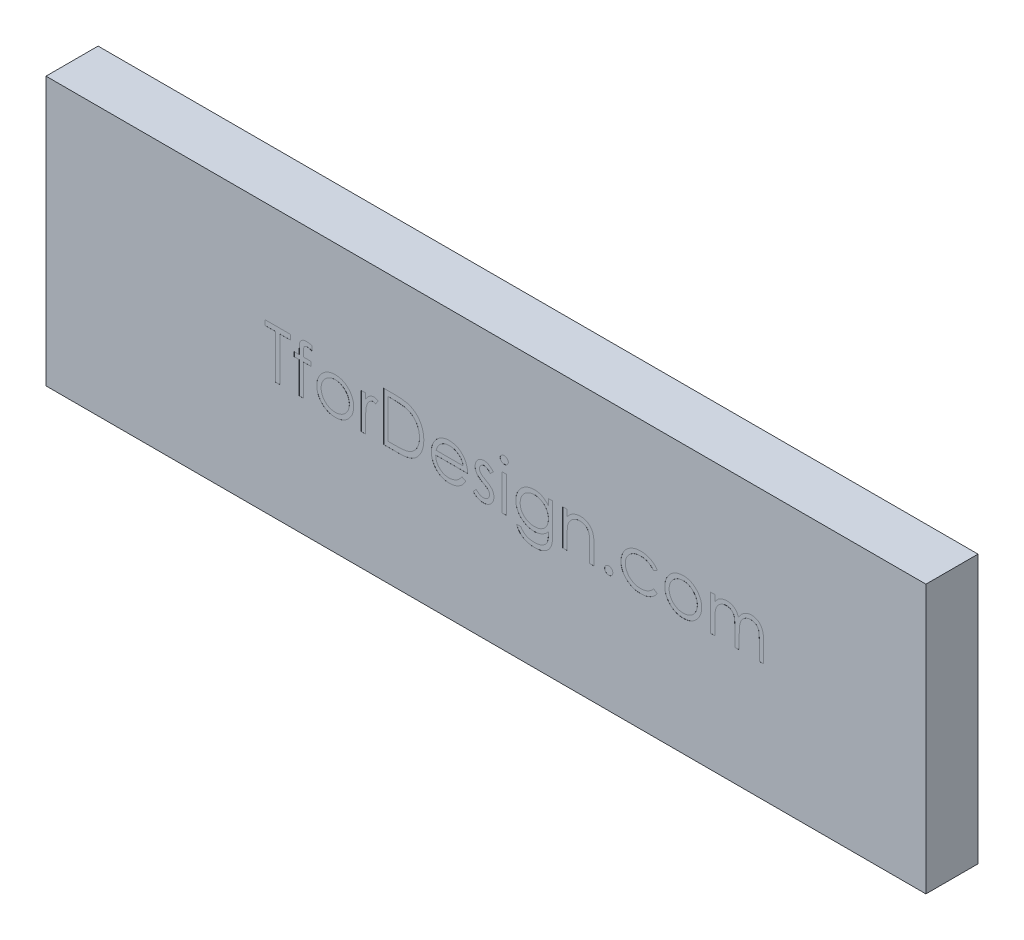
from build123d import *

# Parameters (mm, degrees)
SKETCH1_W           = 42.920186872
SKETCH1_H           = 13.085422827
BOSS_EXTRUDE1_DEPTH = 2.54
SKETCH2_W           = 0.213701923
SKETCH2_H           = 1.740144231
CUT_EXTRUDE1_DEPTH  = 0.00254


with BuildPart() as part:
    # Sketch1 → Boss-Extrude1 (new body)
    with BuildSketch(Plane.XY):
        with Locations((0.924247782, -12.002110783)):
            Rectangle(SKETCH1_W, SKETCH1_H)
    extrude(amount=BOSS_EXTRUDE1_DEPTH)

    # Sketch2 → Cut-Extrude1 (cut)
    # profile 1 of 15: a face of its own
    with BuildSketch(Plane.XY.offset(2.54)):
        Polygon((-9.862506242, -10.650216921), (-9.862506242, -10.405986152), (-8.610823549, -10.405986152), (-8.610823549, -10.650216921), (-9.129813934, -10.650216921), (-9.129813934, -12.787236152), (-9.343515857, -12.787236152), (-9.343515857, -10.650216921), align=None)
    # profile 2 of 15: a face of its own
    with BuildSketch(Plane.XY.offset(2.54)):
        with BuildLine():
            Line((-7.57284278, -10.359238857), (-7.57284278, -10.581527018))
            add(Edge.make_bspline(
                [(-7.57284278, -10.581527018), (-7.593075771, -10.573396156), (-7.631478408, -10.557963613), (-7.688111592, -10.541182858), (-7.740178531, -10.530340864), (-7.773620731, -10.528819623), (-7.789406782, -10.528101537)],
                knots=[0, 0, 0, 0, 1.16548392, 2.212112691, 3.15604595, 4, 4, 4, 4], degree=3))
            add(Edge.make_bspline(
                [(-7.789406782, -10.528101537), (-7.80007054, -10.528544681), (-7.820712017, -10.52940246), (-7.850377852, -10.533775983), (-7.877108546, -10.542690567), (-7.900856835, -10.554276557), (-7.920553487, -10.568805029), (-7.937416972, -10.583402271), (-7.949640628, -10.599856831), (-7.956277477, -10.615178753), (-7.960325602, -10.629364875), (-7.961543529, -10.643893403), (-7.964526836, -10.661735147), (-7.965358782, -10.683617962), (-7.967255188, -10.708861056), (-7.967087384, -10.737998641), (-7.968641267, -10.770572197), (-7.968408643, -10.793636678), (-7.96828674, -10.805723232)],
                knots=[0, 0, 0, 0, 1.311993654, 2.539582093, 3.670788641, 4.763509788, 5.772417512, 6.671800701, 7.496729179, 8.266799162, 8.712543678, 9.304149002, 10.05334463, 10.934920737, 11.99209668, 13.165090968, 14.514413552, 16, 16, 16, 16], degree=3))
            Line((-7.96828674, -10.805723232), (-7.96828674, -11.047091921))
            Line((-7.96828674, -11.047091921), (-7.603371626, -11.047091921))
            Line((-7.603371626, -11.047091921), (-7.603371626, -11.260793844))
            Line((-7.603371626, -11.260793844), (-7.968763754, -11.260793844))
            Line((-7.968763754, -11.260793844), (-7.96971778, -12.787236152))
            Line((-7.96971778, -12.787236152), (-8.183419703, -12.787236152))
            Line((-8.183419703, -12.787236152), (-8.183419703, -11.260793844))
            Line((-8.183419703, -11.260793844), (-8.427650472, -11.260793844))
            Line((-8.427650472, -11.260793844), (-8.427650472, -11.047091921))
            Line((-8.427650472, -11.047091921), (-8.183419703, -11.047091921))
            Line((-8.183419703, -11.047091921), (-8.183419703, -10.768993213))
            add(Edge.make_bspline(
                [(-8.183419703, -10.768993213), (-8.183402548, -10.753565721), (-8.183369639, -10.72396957), (-8.18106469, -10.68137279), (-8.179094566, -10.642032183), (-8.175170519, -10.606253131), (-8.17063818, -10.573700666), (-8.164150186, -10.544858366), (-8.158019235, -10.518949169), (-8.146896354, -10.489623969), (-8.130280522, -10.456388506), (-8.103385871, -10.421265817), (-8.0711417, -10.389761916), (-8.032627822, -10.363222984), (-7.989278503, -10.341168882), (-7.941053987, -10.325356122), (-7.888479254, -10.316415926), (-7.852088672, -10.315086366), (-7.833291999, -10.314399614)],
                knots=[0, 0, 0, 0, 1.116398763, 2.141702935, 3.087165306, 3.966655413, 4.746276475, 5.464069668, 6.106083417, 6.67047701, 7.730773247, 8.782666744, 9.856985883, 10.980834087, 12.154321827, 13.366232824, 14.639591414, 16, 16, 16, 16], degree=3))
            add(Edge.make_bspline(
                [(-7.833291999, -10.314399614), (-7.814189776, -10.315050974), (-7.774085672, -10.316418472), (-7.711359055, -10.324877629), (-7.643597853, -10.339485598), (-7.597105021, -10.352465373), (-7.57284278, -10.359238857)],
                knots=[0, 0, 0, 0, 0.864728408, 1.815451418, 2.859995356, 4, 4, 4, 4], degree=3))
        make_face()
    # profile 3 of 15: a face of its own
    with BuildSketch(Plane.XY.offset(2.54)):
        with BuildLine():
            add(Edge.make_bspline(
                [(-6.427057023, -11.016563075), (-6.394405818, -11.017258326), (-6.330384784, -11.018621543), (-6.236626204, -11.033191368), (-6.147128531, -11.055471271), (-6.061548997, -11.086272102), (-5.980983625, -11.127557501), (-5.904258903, -11.176821679), (-5.831585188, -11.235184479), (-5.788026663, -11.280331665), (-5.765916698, -11.303248021)],
                knots=[0, 0, 0, 0, 1.054011418, 2.066658804, 3.057071809, 4.030435133, 4.997543892, 5.974964718, 6.972108034, 8, 8, 8, 8], degree=3))
            add(Edge.make_bspline(
                [(-5.765916698, -11.303248021), (-5.746878976, -11.325165037), (-5.709171964, -11.368574913), (-5.660821894, -11.438961678), (-5.619169369, -11.511855211), (-5.585789033, -11.588223481), (-5.5594694, -11.66739982), (-5.540782918, -11.749656367), (-5.529667967, -11.834811464), (-5.528169163, -11.892644432), (-5.527410088, -11.921934169)],
                knots=[0, 0, 0, 0, 1.025258237, 2.030674902, 3.01204498, 3.988269485, 4.97094183, 5.956517959, 6.965070386, 8, 8, 8, 8], degree=3))
            add(Edge.make_bspline(
                [(-5.527410088, -11.921934169), (-5.528077748, -11.951393673), (-5.529397075, -12.009607025), (-5.541877285, -12.095345201), (-5.561288613, -12.178481321), (-5.589068846, -12.258667326), (-5.62469106, -12.336148321), (-5.668159545, -12.410585889), (-5.719779342, -12.482126894), (-5.778292775, -12.550163859), (-5.842961998, -12.612869802), (-5.913117806, -12.667521713), (-5.987381533, -12.714344929), (-6.066740671, -12.752061491), (-6.150470515, -12.781799697), (-6.238751663, -12.802686673), (-6.33144697, -12.815315247), (-6.394738705, -12.816936928), (-6.427057023, -12.817764998)],
                knots=[0, 0, 0, 0, 0.998656419, 1.973391657, 2.932242238, 3.890759089, 4.846373663, 5.82037756, 6.809684879, 7.83454468, 8.860553229, 9.859544525, 10.845671541, 11.83227036, 12.833544569, 13.85385346, 14.904124723, 16, 16, 16, 16], degree=3))
            add(Edge.make_bspline(
                [(-6.427057023, -12.817764998), (-6.45953368, -12.816934149), (-6.523140854, -12.815306888), (-6.616163353, -12.802735737), (-6.704602719, -12.781809323), (-6.788442176, -12.751963761), (-6.868142509, -12.714343724), (-6.942836537, -12.667663271), (-7.013049336, -12.612853594), (-7.07773224, -12.550168251), (-7.136242005, -12.482125762), (-7.187862749, -12.410586183), (-7.231330988, -12.336148244), (-7.266953266, -12.258667346), (-7.294733482, -12.178481316), (-7.314144815, -12.095345203), (-7.326625024, -12.009607025), (-7.327944351, -11.951393672), (-7.328612011, -11.921934169)],
                knots=[0, 0, 0, 0, 1.099876186, 2.154163076, 3.173186993, 4.173200201, 5.163417411, 6.152872554, 7.150605724, 8.17532212, 9.198891216, 10.186952605, 11.159729845, 12.11414092, 13.071450619, 14.029093627, 15.002601286, 16, 16, 16, 16], degree=3))
            add(Edge.make_bspline(
                [(-7.328612011, -11.921934169), (-7.327847759, -11.892803626), (-7.326334671, -11.835130158), (-7.315230896, -11.75013514), (-7.296617306, -11.668017809), (-7.270266124, -11.589147083), (-7.23657811, -11.513113474), (-7.195510877, -11.44003983), (-7.146667607, -11.369971345), (-7.109110565, -11.326617572), (-7.0901054, -11.304679061)],
                knots=[0, 0, 0, 0, 1.031353054, 2.041901799, 3.029428768, 4.008703097, 4.981709435, 5.96992636, 6.972712378, 8, 8, 8, 8], degree=3))
            add(Edge.make_bspline(
                [(-7.0901054, -11.304679061), (-7.06802877, -11.281563968), (-7.024611191, -11.236104071), (-6.951575717, -11.177911408), (-6.875039742, -11.127622079), (-6.793584034, -11.087157011), (-6.708074804, -11.055290091), (-6.618118497, -11.03313391), (-6.524041763, -11.018674038), (-6.459707449, -11.017273742), (-6.427057023, -11.016563075)],
                knots=[0, 0, 0, 0, 1.027980169, 2.021703884, 2.998553061, 3.971491411, 4.943284454, 5.930300938, 6.949603206, 8, 8, 8, 8], degree=3))
        make_face()
        with BuildLine():
            add(Edge.make_bspline(
                [(-6.428011049, -11.230264998), (-6.451100746, -11.230921265), (-6.496684081, -11.232216857), (-6.56378062, -11.242071085), (-6.628373832, -11.257683584), (-6.690586264, -11.279865986), (-6.750208118, -11.308508273), (-6.80729648, -11.343688425), (-6.862019265, -11.38494049), (-6.91330599, -11.432199915), (-6.96037467, -11.483824731), (-7.001521293, -11.538830489), (-7.036508732, -11.596324986), (-7.06565534, -11.656368008), (-7.087363623, -11.719568025), (-7.103129555, -11.785209312), (-7.112974486, -11.853425604), (-7.114257897, -11.89979944), (-7.114910088, -11.923365209)],
                knots=[0, 0, 0, 0, 1.021534396, 2.016698045, 2.994645724, 3.958388632, 4.93408049, 5.916473867, 6.921342795, 7.962252576, 8.998418191, 10.008913653, 10.997312074, 11.973003931, 12.956656626, 13.948281152, 14.957379055, 16, 16, 16, 16], degree=3))
            add(Edge.make_bspline(
                [(-7.114910088, -11.923365209), (-7.113816874, -11.95381257), (-7.111647049, -12.014244889), (-7.094001825, -12.10324317), (-7.06448366, -12.188683681), (-7.024623386, -12.270065543), (-6.97468094, -12.345362218), (-6.915838847, -12.412494067), (-6.848728622, -12.470450843), (-6.774150253, -12.518539061), (-6.693627048, -12.556747752), (-6.608408015, -12.583825269), (-6.519525686, -12.60142726), (-6.458782902, -12.603176781), (-6.428011049, -12.604063075)],
                knots=[0, 0, 0, 0, 1.016792936, 2.018143844, 3.017858371, 4.030088057, 5.03801393, 6.028138512, 7.003788237, 7.991172063, 8.984598303, 9.972568034, 10.972917682, 12, 12, 12, 12], degree=3))
            add(Edge.make_bspline(
                [(-6.428011049, -12.604063075), (-6.397240966, -12.603171617), (-6.336501677, -12.601411902), (-6.247742844, -12.58391392), (-6.162756731, -12.556629108), (-6.082317162, -12.518582033), (-6.007772741, -12.470268229), (-5.940179856, -12.412821337), (-5.881840176, -12.345184413), (-5.831947134, -12.269965808), (-5.791434083, -12.188809848), (-5.762054083, -12.103227401), (-5.74436644, -12.014248905), (-5.74220234, -11.953813915), (-5.741112011, -11.923365209)],
                knots=[0, 0, 0, 0, 1.02726834, 2.027799167, 3.010890988, 4.004497153, 4.992059811, 5.971914811, 6.958719428, 7.966827853, 8.981595046, 9.981490638, 10.983022906, 12, 12, 12, 12], degree=3))
            add(Edge.make_bspline(
                [(-5.741112011, -11.923365209), (-5.741763977, -11.899799299), (-5.743046946, -11.853425186), (-5.752895091, -11.78521091), (-5.768649128, -11.719562163), (-5.790401246, -11.656389639), (-5.819421209, -11.596169524), (-5.855083349, -11.538999299), (-5.896061957, -11.483634185), (-5.943698606, -11.432366797), (-5.994931797, -11.384922067), (-6.04967676, -11.343672429), (-6.106680469, -11.308662886), (-6.166129112, -11.279620998), (-6.228349519, -11.257885396), (-6.292852227, -11.241980938), (-6.359662489, -11.232258501), (-6.40508248, -11.230933749), (-6.428011049, -11.230264998)],
                knots=[0, 0, 0, 0, 1.042956736, 2.052379634, 3.044323526, 4.02829302, 5.004299113, 5.996692471, 7.007513377, 8.048758398, 9.090003419, 10.095195979, 11.07790575, 12.047570684, 13.018257071, 13.989683339, 14.985167495, 16, 16, 16, 16], degree=3))
        make_face(mode=Mode.SUBTRACT)
    # profile 4 of 15: a face of its own
    with BuildSketch(Plane.XY.offset(2.54)):
        with BuildLine():
            Line((-5.161063934, -11.047091921), (-4.947362011, -11.047091921))
            Line((-4.947362011, -11.047091921), (-4.947362011, -11.303248021))
            add(Edge.make_bspline(
                [(-4.947362011, -11.303248021), (-4.931585373, -11.279397538), (-4.901412676, -11.233783674), (-4.851261558, -11.173456882), (-4.799892328, -11.123508431), (-4.747059066, -11.083705144), (-4.692373252, -11.053896575), (-4.637035076, -11.03206185), (-4.580173908, -11.019150498), (-4.541963741, -11.017426705), (-4.522820244, -11.016563075)],
                knots=[0, 0, 0, 0, 1.2804753, 2.448899062, 3.506932113, 4.484331642, 5.4025378, 6.288909075, 7.142734305, 8, 8, 8, 8], degree=3))
            add(Edge.make_bspline(
                [(-4.522820244, -11.016563075), (-4.507970547, -11.017373059), (-4.47741633, -11.019039652), (-4.431163889, -11.030749159), (-4.383509327, -11.049444028), (-4.352796381, -11.067024608), (-4.336785088, -11.076189728)],
                knots=[0, 0, 0, 0, 0.901110191, 1.854092781, 2.881294221, 4, 4, 4, 4], degree=3))
            Line((-4.336785088, -11.076189728), (-4.45413034, -11.261270858))
            add(Edge.make_bspline(
                [(-4.45413034, -11.261270858), (-4.464409871, -11.25668507), (-4.483922387, -11.247980366), (-4.512466476, -11.237678391), (-4.5387836, -11.231612384), (-4.555550021, -11.230693414), (-4.563366368, -11.230264998)],
                knots=[0, 0, 0, 0, 1.180555205, 2.24091978, 3.179933427, 4, 4, 4, 4], degree=3))
            add(Edge.make_bspline(
                [(-4.563366368, -11.230264998), (-4.580515269, -11.231408024), (-4.615494055, -11.233739464), (-4.666850474, -11.252067475), (-4.716684733, -11.281680183), (-4.756262239, -11.314521778), (-4.786907058, -11.346190905), (-4.80877389, -11.373846336), (-4.828832687, -11.404856083), (-4.847998498, -11.438690029), (-4.865460744, -11.475925871), (-4.881758475, -11.516191593), (-4.896494237, -11.559533832), (-4.904896814, -11.589729797), (-4.909200953, -11.60519739)],
                knots=[0, 0, 0, 0, 1.125678352, 2.296057538, 3.5422874, 4.923748041, 5.663163013, 6.437101912, 7.23742474, 8.08941207, 8.991984279, 9.93940061, 10.944477711, 12, 12, 12, 12], degree=3))
            add(Edge.make_bspline(
                [(-4.909200953, -11.60519739), (-4.912420671, -11.61899311), (-4.919552101, -11.649549581), (-4.926485986, -11.700813488), (-4.933336855, -11.76138137), (-4.93816509, -11.83142182), (-4.942640508, -11.910759929), (-4.945164689, -11.999516564), (-4.947275932, -12.097782826), (-4.947332448, -12.166481448), (-4.947362011, -12.202417943)],
                knots=[0, 0, 0, 0, 0.566838948, 1.255505196, 2.06880316, 3.007127437, 4.065329342, 5.249902469, 6.561414163, 8, 8, 8, 8], degree=3))
            Line((-4.947362011, -12.202417943), (-4.947362011, -12.787236152))
            Line((-4.947362011, -12.787236152), (-5.161063934, -12.787236152))
            Line((-5.161063934, -12.787236152), (-5.161063934, -11.047091921))
        make_face()
    # profile 5 of 15: a face of its own
    with BuildSketch(Plane.XY.offset(2.54)):
        with BuildLine():
            Line((-4.062025472, -12.787236152), (-4.062025472, -10.405986152))
            Line((-4.062025472, -10.405986152), (-3.581196145, -10.405986152))
            add(Edge.make_bspline(
                [(-3.581196145, -10.405986152), (-3.53937528, -10.406287258), (-3.458577586, -10.406868992), (-3.341819832, -10.410557475), (-3.233790165, -10.417082417), (-3.134843881, -10.426586683), (-3.044709342, -10.438256872), (-2.963638931, -10.452884826), (-2.891213456, -10.470157849), (-2.846670854, -10.484884486), (-2.825607203, -10.491848532)],
                knots=[0, 0, 0, 0, 1.314313732, 2.53924729, 3.670748893, 4.714932338, 5.66265055, 6.526160246, 7.303039223, 8, 8, 8, 8], degree=3))
            add(Edge.make_bspline(
                [(-2.825607203, -10.491848532), (-2.798056318, -10.502346923), (-2.74357931, -10.523105636), (-2.66601375, -10.562264476), (-2.592994173, -10.606632676), (-2.524129005, -10.656268718), (-2.4609913, -10.712578034), (-2.401114498, -10.773168658), (-2.346948052, -10.84024394), (-2.297344372, -10.912412816), (-2.252620647, -10.988825123), (-2.213745613, -11.069335259), (-2.181459949, -11.153534359), (-2.154658486, -11.241188273), (-2.133535807, -11.332489737), (-2.119124529, -11.427545064), (-2.109619266, -11.525978583), (-2.10866401, -11.592772281), (-2.108179319, -11.626662985)],
                knots=[0, 0, 0, 0, 0.984719456, 1.947108742, 2.898477687, 3.838006223, 4.779231079, 5.722358779, 6.681677486, 7.655904652, 8.64651281, 9.637519902, 10.640069247, 11.656948941, 12.698408672, 13.768548281, 14.867775369, 16, 16, 16, 16], degree=3))
            add(Edge.make_bspline(
                [(-2.108179319, -11.626662985), (-2.108607241, -11.656096078), (-2.109450507, -11.714097061), (-2.117022417, -11.799577742), (-2.128028092, -11.882522511), (-2.14506709, -11.962536389), (-2.165751658, -12.040320408), (-2.192261196, -12.11504556), (-2.222629275, -12.187397331), (-2.258041782, -12.256397435), (-2.296918331, -12.321768444), (-2.338639017, -12.383392151), (-2.38315934, -12.440389222), (-2.430903833, -12.492932259), (-2.481255512, -12.540942055), (-2.534544029, -12.584819658), (-2.590906891, -12.623706528), (-2.65009165, -12.659130757), (-2.713824874, -12.690032821), (-2.78331374, -12.716178952), (-2.858854595, -12.737846025), (-2.940262019, -12.755923723), (-3.027676671, -12.770263817), (-3.121184253, -12.779874809), (-3.220641099, -12.786374215), (-3.288934849, -12.786943261), (-3.324086019, -12.787236152)],
                knots=[0, 0, 0, 0, 1.105936401, 2.179363191, 3.223086493, 4.248585256, 5.251745608, 6.245858792, 7.225916811, 8.198733463, 9.158002045, 10.082870192, 10.993790845, 11.873723703, 12.748670949, 13.606408763, 14.465103618, 15.319838547, 16.196477973, 17.123216899, 18.106603292, 19.147568657, 20.255746949, 21.433717677, 22.679120308, 24, 24, 24, 24], degree=3))
            Line((-3.324086019, -12.787236152), (-4.062025472, -12.787236152))
        make_face()
        with BuildLine():
            Line((-3.848323549, -12.543005383), (-3.574994974, -12.543005383))
            add(Edge.make_bspline(
                [(-3.574994974, -12.543005383), (-3.535719064, -12.542836589), (-3.460177107, -12.542511936), (-3.351552648, -12.539663142), (-3.252302558, -12.535008181), (-3.162412746, -12.528493709), (-3.081933963, -12.519874526), (-3.010698019, -12.510264547), (-2.948938424, -12.498291996), (-2.911566789, -12.487439647), (-2.894297107, -12.482424704)],
                knots=[0, 0, 0, 0, 1.375205317, 2.645023457, 3.804390687, 4.853969522, 5.800190428, 6.637939096, 7.370582563, 8, 8, 8, 8], degree=3))
            add(Edge.make_bspline(
                [(-2.894297107, -12.482424704), (-2.872560811, -12.474769626), (-2.829607389, -12.459642311), (-2.767775794, -12.432048617), (-2.71011076, -12.399362851), (-2.655607332, -12.363030233), (-2.605038661, -12.321769292), (-2.557805468, -12.276477244), (-2.514002849, -12.226923585), (-2.474083365, -12.173169818), (-2.438358965, -12.115550511), (-2.407422289, -12.054632125), (-2.380309015, -11.991082135), (-2.359028401, -11.923924654), (-2.342349048, -11.853760062), (-2.330534859, -11.780583424), (-2.323176984, -11.704408406), (-2.322318749, -11.652597764), (-2.321881242, -11.626185972)],
                knots=[0, 0, 0, 0, 0.998632004, 1.973411704, 2.929992603, 3.868527914, 4.809262121, 5.754881198, 6.702106254, 7.672490631, 8.653608572, 9.636854334, 10.631411391, 11.644891563, 12.686317036, 13.754757253, 14.855430412, 16, 16, 16, 16], degree=3))
            add(Edge.make_bspline(
                [(-2.321881242, -11.626185972), (-2.32223046, -11.598336586), (-2.322916504, -11.543626221), (-2.331539561, -11.463350409), (-2.344140834, -11.386143038), (-2.362363306, -11.311998944), (-2.385584493, -11.240773476), (-2.414564062, -11.172860559), (-2.447674744, -11.107542961), (-2.487069693, -11.046328259), (-2.530214945, -10.988434554), (-2.578097038, -10.93539737), (-2.629955246, -10.887095891), (-2.685223956, -10.842777895), (-2.745460804, -10.804226358), (-2.809246797, -10.769741312), (-2.877517691, -10.740475143), (-2.925015258, -10.724909346), (-2.949153627, -10.716998772)],
                knots=[0, 0, 0, 0, 1.122418816, 2.205001699, 3.251619955, 4.274784885, 5.280384055, 6.268708349, 7.249350384, 8.229342522, 9.199999885, 10.157847722, 11.105861043, 12.055065948, 13.010012805, 13.98527497, 14.976112212, 16, 16, 16, 16], degree=3))
            add(Edge.make_bspline(
                [(-2.949153627, -10.716998772), (-2.96912289, -10.711476703), (-3.01158302, -10.699735267), (-3.080870226, -10.686927291), (-3.158849462, -10.675630301), (-3.245866937, -10.666065814), (-3.34182346, -10.659202833), (-3.44679283, -10.654051635), (-3.560820418, -10.650577301), (-3.639866035, -10.650340055), (-3.680891909, -10.650216921)],
                knots=[0, 0, 0, 0, 0.674548936, 1.434276114, 2.292660221, 3.240891867, 4.284742987, 5.42552168, 6.663806718, 8, 8, 8, 8], degree=3))
            Line((-3.680891909, -10.650216921), (-3.848323549, -10.650216921))
            Line((-3.848323549, -10.650216921), (-3.848323549, -12.543005383))
        make_face(mode=Mode.SUBTRACT)
    # profile 6 of 15: a face of its own
    with BuildSketch(Plane.XY.offset(2.54)):
        with BuildLine():
            Line((-0.252597888, -12.237716921), (-0.062746626, -12.337412685))
            add(Edge.make_bspline(
                [(-0.062746626, -12.337412685), (-0.077875453, -12.364248237), (-0.107310158, -12.416459594), (-0.157929238, -12.488190914), (-0.210991702, -12.552721235), (-0.268892794, -12.608326589), (-0.329900201, -12.656802977), (-0.394352239, -12.699214962), (-0.462584453, -12.735354526), (-0.534600069, -12.765802228), (-0.611003871, -12.789212973), (-0.691981009, -12.805748524), (-0.777686616, -12.815969712), (-0.836432856, -12.817157031), (-0.866513904, -12.817764998)],
                knots=[0, 0, 0, 0, 1.120438281, 2.179929193, 3.190490725, 4.156257408, 5.095198341, 6.022838206, 6.959905092, 7.901321166, 8.864066838, 9.862729781, 10.905609505, 12, 12, 12, 12], degree=3))
            add(Edge.make_bspline(
                [(-0.866513904, -12.817764998), (-0.899947999, -12.816984509), (-0.965168234, -12.815462002), (-1.060105097, -12.802336236), (-1.149490023, -12.780923792), (-1.233317985, -12.751011521), (-1.311383697, -12.711940431), (-1.383842314, -12.664342998), (-1.451074884, -12.608463732), (-1.510962784, -12.543818616), (-1.564876925, -12.47463857), (-1.612451456, -12.402550727), (-1.652223387, -12.327736462), (-1.684576145, -12.250672052), (-1.710705169, -12.171843224), (-1.728916087, -12.090532744), (-1.739413827, -12.006960677), (-1.741022494, -11.950424811), (-1.741833165, -11.921934169)],
                knots=[0, 0, 0, 0, 1.145258523, 2.234067595, 3.276747158, 4.290159414, 5.277019952, 6.260822364, 7.254936242, 8.264827045, 9.274100331, 10.257902744, 11.220704747, 12.172965371, 13.118907548, 14.062713208, 15.023725156, 16, 16, 16, 16], degree=3))
            add(Edge.make_bspline(
                [(-1.741833165, -11.921934169), (-1.74111257, -11.89519965), (-1.739684447, -11.842215365), (-1.730682787, -11.763793629), (-1.714729573, -11.687574271), (-1.692838181, -11.613493959), (-1.664568494, -11.541676728), (-1.629984431, -11.472078871), (-1.589032116, -11.404774445), (-1.557414101, -11.362318028), (-1.541487612, -11.340932066)],
                knots=[0, 0, 0, 0, 1.024358464, 2.0301432, 3.019427413, 4.004406732, 4.986367066, 5.972626655, 6.978780325, 8, 8, 8, 8], degree=3))
            add(Edge.make_bspline(
                [(-1.541487612, -11.340932066), (-1.519915063, -11.315167709), (-1.47745333, -11.264455146), (-1.40563731, -11.197822107), (-1.327872355, -11.142003038), (-1.245133016, -11.095733897), (-1.156457665, -11.060577363), (-1.063038308, -11.034378454), (-0.963811222, -11.0196977), (-0.895976063, -11.017624085), (-0.861266758, -11.016563075)],
                knots=[0, 0, 0, 0, 1.030682036, 2.02871468, 2.997146059, 3.962720338, 4.930598197, 5.918074684, 6.934738563, 8, 8, 8, 8], degree=3))
            add(Edge.make_bspline(
                [(-0.861266758, -11.016563075), (-0.825583656, -11.017484312), (-0.755581542, -11.019291569), (-0.653506117, -11.036046271), (-0.556922129, -11.062615955), (-0.465868229, -11.10014023), (-0.380335184, -11.14855414), (-0.300878961, -11.208522071), (-0.2261407, -11.278202948), (-0.182660042, -11.33179006), (-0.160534337, -11.359058568)],
                knots=[0, 0, 0, 0, 1.056321875, 2.072262726, 3.055038591, 4.01806755, 4.982017516, 5.957941055, 6.960871419, 8, 8, 8, 8], degree=3))
            add(Edge.make_bspline(
                [(-0.160534337, -11.359058568), (-0.145480116, -11.37960779), (-0.11547188, -11.420569453), (-0.077884121, -11.487360901), (-0.045255965, -11.557240788), (-0.019175861, -11.631338686), (0.001942085, -11.708776651), (0.017220742, -11.790108275), (0.026180786, -11.87530934), (0.027942025, -11.933361871), (0.028839912, -11.962957306)],
                knots=[0, 0, 0, 0, 0.94817472, 1.890038105, 2.849395472, 3.817997239, 4.812318967, 5.836947057, 6.897266129, 8, 8, 8, 8], degree=3))
            Line((0.028839912, -11.962957306), (-1.528131242, -11.962957306))
            add(Edge.make_bspline(
                [(-1.528131242, -11.962957306), (-1.527083759, -11.985885658), (-1.525023928, -12.030973336), (-1.515420589, -12.096948101), (-1.500283477, -12.159794964), (-1.479009347, -12.219042534), (-1.453246368, -12.275464639), (-1.421687515, -12.328642739), (-1.384036854, -12.378334616), (-1.342041333, -12.424984758), (-1.29529597, -12.466527883), (-1.246117887, -12.503710609), (-1.193802801, -12.534874774), (-1.138763212, -12.560170378), (-1.081088122, -12.579973068), (-1.020759361, -12.593490281), (-0.957895643, -12.602543867), (-0.915042848, -12.603550567), (-0.893226644, -12.604063075)],
                knots=[0, 0, 0, 0, 1.094153842, 2.151609401, 3.174256925, 4.172055639, 5.149267565, 6.128595816, 7.11444997, 8.118368179, 9.117203808, 10.09244225, 11.054858984, 12.015122123, 12.976791628, 13.957293641, 14.960065497, 16, 16, 16, 16], degree=3))
            add(Edge.make_bspline(
                [(-0.893226644, -12.604063075), (-0.871896667, -12.60364938), (-0.829573901, -12.602828528), (-0.766545032, -12.594846639), (-0.704537603, -12.581940076), (-0.643808256, -12.564325636), (-0.585589519, -12.542842099), (-0.531674243, -12.516918548), (-0.482089668, -12.488241667), (-0.435745803, -12.45544187), (-0.390793931, -12.415295229), (-0.346201632, -12.36519664), (-0.298388409, -12.305946018), (-0.268459775, -12.261351556), (-0.252597888, -12.237716921)],
                knots=[0, 0, 0, 0, 0.99110716, 1.966546729, 2.947904876, 3.932708344, 4.903319531, 5.828989031, 6.710028674, 7.56322171, 8.463672341, 9.504779593, 10.677557249, 12, 12, 12, 12], degree=3))
        make_face()
        with BuildLine():
            add(Edge.make_bspline(
                [(-0.184862011, -11.749255383), (-0.192683821, -11.720909749), (-0.207738289, -11.666353529), (-0.23919553, -11.590806066), (-0.274622775, -11.523663047), (-0.31654756, -11.465438333), (-0.364049228, -11.4137288), (-0.418916754, -11.368540441), (-0.480445461, -11.328115354), (-0.548317304, -11.293993743), (-0.620191447, -11.264949392), (-0.69544316, -11.24547409), (-0.772226762, -11.232132598), (-0.824161339, -11.230890192), (-0.850295454, -11.230264998)],
                knots=[0, 0, 0, 0, 1.154881502, 2.222775134, 3.210006277, 4.132804581, 5.035138423, 5.962687519, 6.919655026, 7.923214229, 8.944639381, 9.960483929, 10.97369054, 12, 12, 12, 12], degree=3))
            add(Edge.make_bspline(
                [(-0.850295454, -11.230264998), (-0.871624269, -11.230681153), (-0.913786851, -11.231503805), (-0.975904185, -11.239307589), (-1.035557694, -11.252207055), (-1.093187542, -11.269872499), (-1.148038525, -11.293418708), (-1.201238894, -11.321029797), (-1.251435914, -11.354735767), (-1.282828474, -11.380425274), (-1.298687882, -11.39340352)],
                knots=[0, 0, 0, 0, 1.04873581, 2.073130211, 3.073294108, 4.04793562, 5.032784715, 6.005352987, 6.992311501, 8, 8, 8, 8], degree=3))
            add(Edge.make_bspline(
                [(-1.298687882, -11.39340352), (-1.310045276, -11.403673045), (-1.333029873, -11.424456062), (-1.363741549, -11.460262719), (-1.393146906, -11.498874049), (-1.419907838, -11.54176725), (-1.444453481, -11.588453887), (-1.467422323, -11.638540171), (-1.488095935, -11.692406176), (-1.499727396, -11.729943139), (-1.50571162, -11.749255383)],
                knots=[0, 0, 0, 0, 0.879870761, 1.780643979, 2.707998968, 3.669668524, 4.684282772, 5.740141944, 6.837334558, 8, 8, 8, 8], degree=3))
            Line((-1.50571162, -11.749255383), (-0.184862011, -11.749255383))
        make_face(mode=Mode.SUBTRACT)
    # profile 7 of 15: a face of its own
    with BuildSketch(Plane.XY.offset(2.54)):
        with BuildLine():
            Line((1.280522605, -11.264132937), (1.135510585, -11.413438075))
            add(Edge.make_bspline(
                [(1.135510585, -11.413438075), (1.122998475, -11.398937524), (1.098876599, -11.370982168), (1.060619109, -11.333605342), (1.02250305, -11.302215746), (0.985050197, -11.275714299), (0.947318767, -11.255678362), (0.909751543, -11.241054179), (0.872309626, -11.2320042), (0.847281984, -11.23083777), (0.834992256, -11.230264998)],
                knots=[0, 0, 0, 0, 1.26578478, 2.440284043, 3.530471711, 4.527705817, 5.468200915, 6.346673037, 7.188140097, 8, 8, 8, 8], degree=3))
            add(Edge.make_bspline(
                [(0.834992256, -11.230264998), (0.819929564, -11.230996296), (0.790288318, -11.232435386), (0.747816466, -11.246800059), (0.708389345, -11.268849576), (0.674264685, -11.30012463), (0.645357889, -11.336023177), (0.624257509, -11.376161748), (0.611353867, -11.419329078), (0.60971779, -11.449285106), (0.608887989, -11.46447849)],
                knots=[0, 0, 0, 0, 0.99966794, 1.967205029, 2.953328237, 3.988086729, 5.028030931, 6.008226631, 6.989793394, 8, 8, 8, 8], degree=3))
            add(Edge.make_bspline(
                [(0.608887989, -11.46447849), (0.609643738, -11.478229899), (0.611153106, -11.505693951), (0.622887007, -11.546207881), (0.641573746, -11.585707402), (0.659038646, -11.609902879), (0.668037629, -11.622369866)],
                knots=[0, 0, 0, 0, 0.960159726, 1.917612774, 2.927026955, 4, 4, 4, 4], degree=3))
            add(Edge.make_bspline(
                [(0.668037629, -11.622369866), (0.673455648, -11.629026878), (0.684987221, -11.643195489), (0.706628371, -11.662860432), (0.731136538, -11.68459257), (0.760609567, -11.706321026), (0.793777677, -11.72920261), (0.831360119, -11.752336204), (0.872164202, -11.777485215), (0.901376905, -11.793435804), (0.916561517, -11.801726837)],
                knots=[0, 0, 0, 0, 0.66740084, 1.420478572, 2.27185888, 3.217733974, 4.268547843, 5.408967954, 6.65319498, 8, 8, 8, 8], degree=3))
            add(Edge.make_bspline(
                [(0.916561517, -11.801726837), (0.935076468, -11.812098816), (0.970841258, -11.832134063), (1.021659016, -11.863232986), (1.067778413, -11.89414258), (1.109590216, -11.924532279), (1.146289911, -11.955252355), (1.178990973, -11.985125311), (1.206877753, -12.015053751), (1.222494621, -12.035963245), (1.229959203, -12.045957607)],
                knots=[0, 0, 0, 0, 1.27191281, 2.456916733, 3.569705269, 4.599008579, 5.553216877, 6.436649441, 7.252746552, 8, 8, 8, 8], degree=3))
            add(Edge.make_bspline(
                [(1.229959203, -12.045957607), (1.242348865, -12.066141141), (1.267006593, -12.106310122), (1.292899807, -12.172453373), (1.307908672, -12.24260534), (1.309992076, -12.29059244), (1.311051451, -12.314993063)],
                knots=[0, 0, 0, 0, 0.995354457, 1.980940102, 2.973342416, 4, 4, 4, 4], degree=3))
            add(Edge.make_bspline(
                [(1.311051451, -12.314993063), (1.310561911, -12.332185107), (1.309597219, -12.366063908), (1.302890212, -12.415957784), (1.291354773, -12.463674331), (1.275642773, -12.509731301), (1.254426262, -12.553246223), (1.229560707, -12.595316956), (1.199710097, -12.635033438), (1.165630072, -12.672343516), (1.128315549, -12.706419712), (1.08851048, -12.736371724), (1.046165847, -12.761255335), (1.001584219, -12.781846579), (0.954664305, -12.79822159), (0.905398767, -12.809558062), (0.853944203, -12.816343102), (0.818953566, -12.81728504), (0.801124317, -12.817764998)],
                knots=[0, 0, 0, 0, 1.032770009, 2.035186124, 3.017557409, 3.978232242, 4.952395191, 5.920591857, 6.910227898, 7.931268572, 8.952309245, 9.941945286, 10.918353717, 11.897095711, 12.887975737, 13.898235213, 14.929059601, 16, 16, 16, 16], degree=3))
            add(Edge.make_bspline(
                [(0.801124317, -12.817764998), (0.777062007, -12.817089608), (0.72927173, -12.815748211), (0.658589617, -12.80315748), (0.589519244, -12.783566328), (0.5225833, -12.756545308), (0.459278711, -12.722424912), (0.401359279, -12.681561034), (0.348623802, -12.635303554), (0.318607619, -12.599848163), (0.303599528, -12.582120467)],
                knots=[0, 0, 0, 0, 1.013940152, 2.01379169, 3.017749504, 4.037548394, 5.051665909, 6.043208538, 7.021604269, 8, 8, 8, 8], degree=3))
            Line((0.303599528, -12.582120467), (0.445272454, -12.420889998))
            add(Edge.make_bspline(
                [(0.445272454, -12.420889998), (0.458724757, -12.435418865), (0.484804079, -12.46358527), (0.5265108, -12.501089509), (0.568951071, -12.532522873), (0.611701099, -12.558814197), (0.655393698, -12.579072105), (0.699784018, -12.59330422), (0.744781767, -12.602451072), (0.775004685, -12.603524867), (0.790153013, -12.604063075)],
                knots=[0, 0, 0, 0, 1.179806542, 2.287233372, 3.337373186, 4.324005949, 5.273901747, 6.200048787, 7.097828587, 8, 8, 8, 8], degree=3))
            add(Edge.make_bspline(
                [(0.790153013, -12.604063075), (0.810780031, -12.603130425), (0.851081763, -12.601308182), (0.90880582, -12.584763875), (0.962104064, -12.55882189), (1.008384233, -12.522024979), (1.047778382, -12.479192706), (1.076304515, -12.430945778), (1.094181698, -12.378700162), (1.09628128, -12.342483185), (1.097349528, -12.324056314)],
                knots=[0, 0, 0, 0, 1.072336372, 2.095165389, 3.102688358, 4.141489647, 5.156069229, 6.117746104, 7.042326257, 8, 8, 8, 8], degree=3))
            add(Edge.make_bspline(
                [(1.097349528, -12.324056314), (1.096610459, -12.308877806), (1.095151268, -12.278909873), (1.083691828, -12.235536873), (1.065585584, -12.194396166), (1.047757064, -12.170318567), (1.038676901, -12.158055713)],
                knots=[0, 0, 0, 0, 1.013901739, 2.00181326, 2.98231254, 4, 4, 4, 4], degree=3))
            add(Edge.make_bspline(
                [(1.038676901, -12.158055713), (1.033218808, -12.15190844), (1.021329109, -12.138517459), (0.999520097, -12.119178254), (0.973406723, -12.098333404), (0.942695291, -12.076336377), (0.907323889, -12.053477326), (0.867149157, -12.029876177), (0.822721459, -12.004411956), (0.79130894, -11.987525727), (0.77488859, -11.978698742)],
                knots=[0, 0, 0, 0, 0.615000592, 1.339693406, 2.178160186, 3.116406724, 4.166410947, 5.330106347, 6.604359322, 8, 8, 8, 8], degree=3))
            add(Edge.make_bspline(
                [(0.77488859, -11.978698742), (0.757167573, -11.96880694), (0.722800864, -11.949623579), (0.674123154, -11.91974496), (0.6302079, -11.889355261), (0.589998402, -11.860159204), (0.554510289, -11.830617455), (0.523883367, -11.800697218), (0.496911822, -11.771605156), (0.481979744, -11.750992174), (0.474847274, -11.741146158)],
                knots=[0, 0, 0, 0, 1.262093308, 2.447601706, 3.550203992, 4.582594899, 5.537233252, 6.418365656, 7.244515135, 8, 8, 8, 8], degree=3))
            add(Edge.make_bspline(
                [(0.474847274, -11.741146158), (0.462511991, -11.721316731), (0.437837114, -11.681650947), (0.413878208, -11.615445069), (0.397409463, -11.545745842), (0.395938265, -11.497653536), (0.395186066, -11.473064728)],
                knots=[0, 0, 0, 0, 0.985009483, 1.970363186, 2.962279964, 4, 4, 4, 4], degree=3))
            add(Edge.make_bspline(
                [(0.395186066, -11.473064728), (0.39554951, -11.45699102), (0.39626082, -11.425532495), (0.401937755, -11.379309834), (0.412273545, -11.335394036), (0.425237697, -11.293125581), (0.443255599, -11.253323264), (0.464786116, -11.215456306), (0.490086846, -11.179577047), (0.519235585, -11.146237416), (0.551284928, -11.115955178), (0.585911548, -11.089558254), (0.622336683, -11.067034109), (0.660714554, -11.048143884), (0.70141384, -11.033855443), (0.744150057, -11.024019258), (0.7888367, -11.017450272), (0.819385502, -11.016863067), (0.834992256, -11.016563075)],
                knots=[0, 0, 0, 0, 1.087655834, 2.128696564, 3.144119009, 4.137814668, 5.115653402, 6.093965665, 7.082169637, 8.081268856, 9.086088321, 10.061021666, 11.022561449, 11.980240094, 12.950172527, 13.934149372, 14.944599409, 16, 16, 16, 16], degree=3))
            add(Edge.make_bspline(
                [(0.834992256, -11.016563075), (0.853492571, -11.017314421), (0.890840246, -11.018831208), (0.946870805, -11.030877401), (1.002818846, -11.050698317), (1.058828125, -11.078073325), (1.11448834, -11.113497396), (1.170289094, -11.156311794), (1.226900272, -11.206234847), (1.262249121, -11.244402355), (1.280522605, -11.264132937)],
                knots=[0, 0, 0, 0, 0.845714091, 1.707292901, 2.609013841, 3.555613372, 4.552488639, 5.621697636, 6.770543573, 8, 8, 8, 8], degree=3))
        make_face()
    # profile 8 of 15: a face of its own
    with BuildSketch(Plane.XY.offset(2.54)):
        with BuildLine():
            add(Edge.make_bspline(
                [(1.813823386, -10.314399614), (1.827084442, -10.31501476), (1.853052136, -10.316219335), (1.89060327, -10.326534555), (1.924795987, -10.344019519), (1.955124766, -10.367478016), (1.98114971, -10.39506612), (1.999370158, -10.427220457), (2.011080735, -10.461958567), (2.012494895, -10.486189547), (2.013214912, -10.498526717)],
                knots=[0, 0, 0, 0, 1.055194115, 2.066272739, 3.074728998, 4.095836921, 5.109056067, 6.073838105, 7.019297344, 8, 8, 8, 8], degree=3))
            add(Edge.make_bspline(
                [(2.013214912, -10.498526717), (2.012478657, -10.510543629), (2.011023168, -10.534299643), (1.999379203, -10.568435523), (1.980994431, -10.60014308), (1.955141454, -10.627677617), (1.924791565, -10.651123146), (1.890604445, -10.668611548), (1.853051827, -10.678925856), (1.827084337, -10.680130557), (1.813823386, -10.680745768)],
                knots=[0, 0, 0, 0, 0.96129708, 1.900370562, 2.859976407, 3.87933698, 4.906634145, 5.921202961, 6.938410037, 8, 8, 8, 8], degree=3))
            add(Edge.make_bspline(
                [(1.813823386, -10.680745768), (1.800714077, -10.680154047), (1.775198521, -10.679002341), (1.738209651, -10.668409168), (1.704308482, -10.651117161), (1.673920553, -10.627831132), (1.648590726, -10.599973978), (1.630154186, -10.568454873), (1.618537114, -10.534294716), (1.617078001, -10.510541974), (1.616339912, -10.498526717)],
                knots=[0, 0, 0, 0, 1.054934014, 2.053291228, 3.073705704, 4.106921865, 5.123545215, 6.088680038, 7.033164197, 8, 8, 8, 8], degree=3))
            add(Edge.make_bspline(
                [(1.616339912, -10.498526717), (1.61706183, -10.486191264), (1.618479722, -10.461963656), (1.630162894, -10.427200785), (1.648437156, -10.395236585), (1.673937325, -10.367324593), (1.704304019, -10.344025467), (1.738210804, -10.326736925), (1.775198216, -10.316142853), (1.800713974, -10.31499127), (1.813823386, -10.314399614)],
                knots=[0, 0, 0, 0, 0.98631895, 1.937192651, 2.907499808, 3.917963147, 4.944918757, 5.95915025, 6.951458133, 8, 8, 8, 8], degree=3))
        make_face()
    # profile 9 of 15: a face of its own
    with BuildSketch(Plane.XY.offset(2.54)):
        with Locations((1.814777413, -11.917164037)):
            Rectangle(SKETCH2_W, SKETCH2_H)
    # profile 10 of 15: a face of its own
    with BuildSketch(Plane.XY.offset(2.54)):
        with BuildLine():
            Line((3.967061066, -11.047091921), (4.180762989, -11.047091921))
            Line((4.180762989, -11.047091921), (4.180762989, -12.428045197))
            add(Edge.make_bspline(
                [(4.180762989, -12.428045197), (4.180574501, -12.457462203), (4.180210674, -12.514244111), (4.177590638, -12.596348441), (4.172065678, -12.672185188), (4.165800486, -12.742100225), (4.156787987, -12.805769482), (4.14578228, -12.863382944), (4.133375506, -12.9149959), (4.122476037, -12.946785479), (4.117320231, -12.961822991)],
                knots=[0, 0, 0, 0, 1.307562039, 2.523909702, 3.650326591, 4.686913197, 5.643429486, 6.506965704, 7.293745905, 8, 8, 8, 8], degree=3))
            add(Edge.make_bspline(
                [(4.117320231, -12.961822991), (4.109707552, -12.981369598), (4.094709809, -13.019878382), (4.066620834, -13.074466376), (4.035165267, -13.125864901), (3.999237817, -13.173787525), (3.959000949, -13.21799367), (3.915402648, -13.259443748), (3.867593821, -13.297260834), (3.815601805, -13.330792438), (3.760625115, -13.360991487), (3.702695356, -13.387148884), (3.64213919, -13.409931897), (3.578387758, -13.426997156), (3.512440581, -13.441784529), (3.44352215, -13.451407967), (3.372035122, -13.457957804), (3.323426748, -13.458563481), (3.298765543, -13.458870768)],
                knots=[0, 0, 0, 0, 0.981931301, 1.934503488, 2.87077864, 3.801706999, 4.735015492, 5.667491629, 6.616593066, 7.585388521, 8.561939025, 9.551802639, 10.560317337, 11.588439944, 12.640189604, 13.723962949, 14.845264515, 16, 16, 16, 16], degree=3))
            add(Edge.make_bspline(
                [(3.298765543, -13.458870768), (3.262785036, -13.458288051), (3.192505439, -13.45714985), (3.090040257, -13.443889067), (2.992725563, -13.425142252), (2.901847228, -13.396767667), (2.817979537, -13.362044286), (2.741695257, -13.322178791), (2.6736792, -13.276466065), (2.612362915, -13.224418335), (2.557021584, -13.162530544), (2.504955695, -13.089597045), (2.454839947, -13.004506894), (2.425469856, -12.942055065), (2.410089912, -12.909351537)],
                knots=[0, 0, 0, 0, 1.157897085, 2.2616841, 3.32207898, 4.345638746, 5.321241055, 6.241986252, 7.112515963, 7.955008012, 8.825025602, 9.77857164, 10.836726669, 12, 12, 12, 12], degree=3))
            Line((2.410089912, -12.909351537), (2.623791835, -12.909351537))
            add(Edge.make_bspline(
                [(2.623791835, -12.909351537), (2.64097916, -12.936637856), (2.674578263, -12.98997925), (2.737408212, -13.05904445), (2.806264659, -13.118067722), (2.883471372, -13.165632016), (2.969349599, -13.201493499), (3.063951005, -13.227058121), (3.16804539, -13.242363616), (3.240515818, -13.244208265), (3.278253975, -13.245168844)],
                knots=[0, 0, 0, 0, 0.997731894, 1.950442991, 2.880492273, 3.800895997, 4.748200782, 5.754801363, 6.83083817, 8, 8, 8, 8], degree=3))
            add(Edge.make_bspline(
                [(3.278253975, -13.245168844), (3.31551502, -13.244195833), (3.387350585, -13.242319963), (3.490650005, -13.22705129), (3.584944061, -13.201487936), (3.669689484, -13.165695444), (3.743886355, -13.12184615), (3.807848084, -13.072860385), (3.859653659, -13.01762831), (3.894496766, -12.966749974), (3.916155676, -12.921421771), (3.929948037, -12.882401523), (3.94115622, -12.838278404), (3.950531431, -12.789200341), (3.958267713, -12.735097214), (3.963168245, -12.675845316), (3.966710056, -12.611579309), (3.966941357, -12.567020585), (3.967061066, -12.543959409)],
                knots=[0, 0, 0, 0, 1.570740765, 3.028230971, 4.391408896, 5.680370741, 6.894727393, 8.017376726, 9.065722033, 10.075533815, 10.603371122, 11.180248986, 11.817768598, 12.521299649, 13.286540596, 14.121245857, 15.027658897, 16, 16, 16, 16], degree=3))
            Line((3.967061066, -12.543959409), (3.967061066, -12.453803911))
            add(Edge.make_bspline(
                [(3.967061066, -12.453803911), (3.94537052, -12.479617887), (3.902370958, -12.530791779), (3.828111795, -12.597848893), (3.747001715, -12.655601778), (3.659178804, -12.702967313), (3.566794304, -12.740850568), (3.470848822, -12.767345689), (3.372202442, -12.784463407), (3.30535589, -12.786305349), (3.27157579, -12.787236152)],
                knots=[0, 0, 0, 0, 1.012485704, 2.007162095, 2.997754123, 3.998611389, 4.999708251, 5.992315798, 6.98544096, 8, 8, 8, 8], degree=3))
            add(Edge.make_bspline(
                [(3.27157579, -12.787236152), (3.251684685, -12.78688575), (3.212137866, -12.786189093), (3.153385797, -12.780093925), (3.095500713, -12.771250138), (3.038617615, -12.758267944), (2.982654421, -12.741604823), (2.927703613, -12.720774506), (2.873320267, -12.697223863), (2.820492918, -12.669483795), (2.769747711, -12.638621226), (2.721467401, -12.605189231), (2.675904877, -12.569362788), (2.633493801, -12.53078862), (2.594289805, -12.489522556), (2.557765602, -12.446004496), (2.524525157, -12.399626766), (2.493886369, -12.351235033), (2.467313285, -12.300506976), (2.443987668, -12.248542593), (2.423706627, -12.195452995), (2.407537666, -12.14106044), (2.395188426, -12.085399219), (2.385996647, -12.028560517), (2.380783116, -11.970369307), (2.379970141, -11.93116621), (2.379561066, -11.911439878)],
                knots=[0, 0, 0, 0, 1.028754217, 2.045334182, 3.052854819, 4.056607503, 5.061168794, 6.071104265, 7.095078842, 8.125279047, 9.155117945, 10.165957491, 11.161587969, 12.151493252, 13.128948131, 14.104219989, 15.088194871, 16.07871515, 17.064853787, 18.047899887, 19.02414258, 20.002704429, 20.980574569, 21.971845993, 22.979467364, 24, 24, 24, 24], degree=3))
            add(Edge.make_bspline(
                [(2.379561066, -11.911439878), (2.379914285, -11.891707415), (2.380619353, -11.852318914), (2.386709216, -11.793890261), (2.395396145, -11.736243985), (2.409144645, -11.67997427), (2.425692647, -11.624440287), (2.446187435, -11.570052227), (2.470829126, -11.516793523), (2.498730402, -11.464624737), (2.530084044, -11.414245913), (2.564464178, -11.366398677), (2.601912311, -11.321435117), (2.64191181, -11.278901623), (2.684951079, -11.239208572), (2.73100785, -11.202452301), (2.779628131, -11.168016686), (2.830962609, -11.136644509), (2.884219189, -11.108898016), (2.93804484, -11.08358016), (2.993152568, -11.063486411), (3.048514956, -11.04578141), (3.105107005, -11.033238893), (3.162234821, -11.023562689), (3.220093983, -11.017667584), (3.258842292, -11.01693172), (3.278253975, -11.016563075)],
                knots=[0, 0, 0, 0, 1.008818848, 2.013730394, 3.001654427, 3.987803273, 4.973046549, 5.963777569, 6.957074694, 7.972068341, 8.987420212, 9.989399531, 10.982630087, 11.977756091, 12.973280677, 13.973972381, 14.989194003, 16.018387222, 17.047741039, 18.059210846, 19.057554164, 20.045176975, 21.029480261, 22.018708529, 23.007435371, 24, 24, 24, 24], degree=3))
            add(Edge.make_bspline(
                [(3.278253975, -11.016563075), (3.310265417, -11.017486098), (3.37347818, -11.019308783), (3.466504094, -11.03361067), (3.556271939, -11.056412168), (3.643288268, -11.089079945), (3.728261916, -11.133677382), (3.810912828, -11.192421423), (3.891480132, -11.265838994), (3.941199156, -11.322140496), (3.967061066, -11.351426357)],
                knots=[0, 0, 0, 0, 0.96728863, 1.910097829, 2.838038873, 3.762875196, 4.71315279, 5.730631239, 6.819562287, 8, 8, 8, 8], degree=3))
            Line((3.967061066, -11.351426357), (3.967061066, -11.047091921))
        make_face()
        with BuildLine():
            add(Edge.make_bspline(
                [(3.295426451, -11.230264998), (3.264177168, -11.23132708), (3.202310215, -11.233429778), (3.111626539, -11.251380806), (3.024080268, -11.279510784), (2.941345147, -11.319748885), (2.863847631, -11.368798715), (2.795080655, -11.428221303), (2.734933739, -11.496084341), (2.684054633, -11.571774241), (2.643552042, -11.653432253), (2.614879466, -11.739504735), (2.596339718, -11.8286009), (2.59429344, -11.889406189), (2.593262989, -11.920026116)],
                knots=[0, 0, 0, 0, 1.026226791, 2.031711442, 3.026614839, 4.04107745, 5.047145931, 6.032893242, 7.017642609, 8.019221815, 9.021877557, 10.003543541, 10.994637589, 12, 12, 12, 12], degree=3))
            add(Edge.make_bspline(
                [(2.593262989, -11.920026116), (2.593756763, -11.94311286), (2.594727872, -11.988517735), (2.604064806, -12.055150482), (2.619155784, -12.118614409), (2.640544312, -12.178913357), (2.667046056, -12.236393191), (2.700378366, -12.290657956), (2.739601616, -12.341755979), (2.784408807, -12.389309325), (2.833786666, -12.432621519), (2.887343836, -12.470679365), (2.945007675, -12.501806195), (3.005359987, -12.528708086), (3.069865162, -12.548356166), (3.137594094, -12.563350407), (3.209025945, -12.571928865), (3.257720289, -12.572992126), (3.282547094, -12.573534229)],
                knots=[0, 0, 0, 0, 1.039728707, 2.044842319, 3.024901384, 3.974314358, 4.923051295, 5.871625912, 6.837440708, 7.820715446, 8.810779094, 9.792721783, 10.773906224, 11.758876063, 12.764959493, 13.806266761, 14.881525401, 16, 16, 16, 16], degree=3))
            add(Edge.make_bspline(
                [(3.282547094, -12.573534229), (3.307695651, -12.573011981), (3.356873387, -12.57199073), (3.428699328, -12.563211742), (3.496757317, -12.549045362), (3.560984952, -12.528931947), (3.621624736, -12.503267684), (3.677995464, -12.470789735), (3.731305834, -12.433802506), (3.779853677, -12.390659689), (3.823753153, -12.343112933), (3.862010157, -12.291375246), (3.894609095, -12.236225143), (3.921604081, -12.177668841), (3.942212918, -12.115251276), (3.95603703, -12.049128484), (3.965702691, -11.979617252), (3.966601391, -11.93198639), (3.967061066, -11.907623772)],
                knots=[0, 0, 0, 0, 1.121943988, 2.193949579, 3.223793937, 4.220241907, 5.192961521, 6.155822191, 7.11847367, 8.083710714, 9.04790392, 10.001595906, 10.949595423, 11.902125208, 12.873731292, 13.87582262, 14.913508608, 16, 16, 16, 16], degree=3))
            add(Edge.make_bspline(
                [(3.967061066, -11.907623772), (3.966149681, -11.875906982), (3.964369156, -11.81394352), (3.947566268, -11.723655523), (3.920474304, -11.638768264), (3.882478567, -11.559550217), (3.834865807, -11.486840755), (3.777517926, -11.421986497), (3.71142393, -11.364903949), (3.636773716, -11.317348214), (3.556459293, -11.278931553), (3.472420765, -11.250110418), (3.384782898, -11.233785715), (3.325383358, -11.231445325), (3.295426451, -11.230264998)],
                knots=[0, 0, 0, 0, 1.070913519, 2.092188694, 3.091357305, 4.074328408, 5.051968682, 6.018948707, 6.99050112, 7.9935919, 9.000589572, 9.992915277, 10.987769056, 12, 12, 12, 12], degree=3))
        make_face(mode=Mode.SUBTRACT)
    # profile 11 of 15: a face of its own
    with BuildSketch(Plane.XY.offset(2.54)):
        with BuildLine():
            Line((4.669224528, -11.047091921), (4.882926451, -11.047091921))
            Line((4.882926451, -11.047091921), (4.882926451, -11.360966621))
            add(Edge.make_bspline(
                [(4.882926451, -11.360966621), (4.90574402, -11.332498626), (4.95002231, -11.277255487), (5.023762366, -11.204647382), (5.101693126, -11.14481322), (5.183337347, -11.097117603), (5.268805859, -11.061163024), (5.357577682, -11.03519656), (5.450184294, -11.019626703), (5.51316117, -11.017592279), (5.545020802, -11.016563075)],
                knots=[0, 0, 0, 0, 1.12780773, 2.188550248, 3.19190651, 4.159438251, 5.104880172, 6.052711206, 7.014878035, 8, 8, 8, 8], degree=3))
            add(Edge.make_bspline(
                [(5.545020802, -11.016563075), (5.577222537, -11.017750431), (5.6402491, -11.020074374), (5.732014352, -11.038455373), (5.81772125, -11.069850627), (5.897064198, -11.11285741), (5.968588249, -11.166337886), (6.031402121, -11.228643484), (6.083356401, -11.30030964), (6.118188893, -11.366796288), (6.141134378, -11.425775628), (6.155579951, -11.476289935), (6.167847458, -11.53256782), (6.178482629, -11.594439219), (6.185678843, -11.662337631), (6.191354581, -11.735984721), (6.195422228, -11.815356635), (6.195583613, -11.870252358), (6.195666835, -11.898560521)],
                knots=[0, 0, 0, 0, 1.235846778, 2.418850247, 3.575807741, 4.728682307, 5.871620074, 6.994088408, 8.11269785, 9.256955736, 9.865816715, 10.540099792, 11.271859618, 12.076849838, 12.949306005, 13.892391288, 14.913166135, 16, 16, 16, 16], degree=3))
            Line((6.195666835, -11.898560521), (6.195666835, -12.787236152))
            Line((6.195666835, -12.787236152), (5.981964912, -12.787236152))
            Line((5.981964912, -12.787236152), (5.981964912, -11.968681465))
            add(Edge.make_bspline(
                [(5.981964912, -11.968681465), (5.981833462, -11.944989766), (5.981582019, -11.899671577), (5.980788963, -11.834786581), (5.978877291, -11.77594482), (5.976191028, -11.723286968), (5.972259224, -11.67686359), (5.968161684, -11.636580135), (5.963150869, -11.60248775), (5.958685744, -11.581964721), (5.956683212, -11.572760491)],
                knots=[0, 0, 0, 0, 1.430800155, 2.736877192, 3.918605307, 4.986035426, 5.920637409, 6.731861385, 7.431261377, 8, 8, 8, 8], degree=3))
            add(Edge.make_bspline(
                [(5.956683212, -11.572760491), (5.949454055, -11.545742703), (5.935540166, -11.493741819), (5.90115901, -11.423206233), (5.857742576, -11.363199966), (5.804744218, -11.314094018), (5.742675865, -11.275877788), (5.671709755, -11.249361579), (5.592530715, -11.232777011), (5.536840502, -11.231125694), (5.50781377, -11.230264998)],
                knots=[0, 0, 0, 0, 1.084156227, 2.086665306, 3.027808233, 3.945421172, 4.874247719, 5.839848303, 6.874090471, 8, 8, 8, 8], degree=3))
            add(Edge.make_bspline(
                [(5.50781377, -11.230264998), (5.490622721, -11.230588852), (5.45660208, -11.231229749), (5.406153616, -11.237660007), (5.357219492, -11.248177277), (5.309308599, -11.262375404), (5.26337919, -11.281875984), (5.217955627, -11.304007573), (5.174748347, -11.331594839), (5.132836035, -11.362340601), (5.093842857, -11.396412347), (5.057560541, -11.432365487), (5.02521771, -11.470652996), (4.995915629, -11.51065796), (4.970621132, -11.5529298), (4.948541442, -11.597060694), (4.929807335, -11.643108728), (4.920498217, -11.675068546), (4.915840363, -11.69105977)],
                knots=[0, 0, 0, 0, 1.023777757, 2.026029729, 3.023749952, 4.003683103, 4.997618607, 5.993177895, 7.010360494, 8.046726602, 9.087585522, 10.09234134, 11.086953743, 12.070360549, 13.043493632, 14.017870808, 15.008233677, 16, 16, 16, 16], degree=3))
            add(Edge.make_bspline(
                [(4.915840363, -11.69105977), (4.913159995, -11.702799471), (4.907324974, -11.728356185), (4.901022703, -11.770296406), (4.895302549, -11.818812657), (4.890514904, -11.873848322), (4.887585683, -11.935596091), (4.884391817, -12.003792259), (4.883229045, -12.078708758), (4.88303014, -12.130866088), (4.882926451, -12.158055713)],
                knots=[0, 0, 0, 0, 0.615963638, 1.340920617, 2.168419149, 3.115676021, 4.16674242, 5.331190069, 6.6087489, 8, 8, 8, 8], degree=3))
            Line((4.882926451, -12.158055713), (4.882926451, -12.787236152))
            Line((4.882926451, -12.787236152), (4.669224528, -12.787236152))
            Line((4.669224528, -12.787236152), (4.669224528, -11.047091921))
        make_face()
    # profile 12 of 15: a face of its own
    with BuildSketch(Plane.XY.offset(2.54)):
        with BuildLine():
            add(Edge.make_bspline(
                [(6.91309472, -12.420889998), (6.926355025, -12.421677965), (6.952350303, -12.423222682), (6.989932638, -12.433820384), (7.023946862, -12.452638151), (7.054244693, -12.477718005), (7.079218207, -12.508127019), (7.098706596, -12.54186995), (7.109211981, -12.579766926), (7.110745446, -12.60591283), (7.11153222, -12.619327498)],
                knots=[0, 0, 0, 0, 1.020151414, 1.999887582, 2.974338812, 3.990962822, 5.007586832, 5.987933904, 6.967670073, 8, 8, 8, 8], degree=3))
            add(Edge.make_bspline(
                [(7.11153222, -12.619327498), (7.110718784, -12.632419835), (7.109114702, -12.658237731), (7.098730677, -12.695848869), (7.079069682, -12.729612888), (7.054416946, -12.760434521), (7.023939372, -12.785567507), (6.989852223, -12.804225175), (6.952438528, -12.815581683), (6.926369744, -12.817028324), (6.91309472, -12.817764998)],
                knots=[0, 0, 0, 0, 1.009421747, 1.99056486, 2.972319754, 3.999869655, 5.017953583, 5.993804169, 6.978383603, 8, 8, 8, 8], degree=3))
            add(Edge.make_bspline(
                [(6.91309472, -12.817764998), (6.899810131, -12.81705498), (6.873875132, -12.815668837), (6.83660109, -12.803991999), (6.802306349, -12.785742466), (6.771834709, -12.760387658), (6.746975499, -12.729771489), (6.728180372, -12.695616338), (6.716893146, -12.658345396), (6.715408693, -12.632441041), (6.71465722, -12.619327498)],
                knots=[0, 0, 0, 0, 1.022052826, 1.995314843, 2.982371812, 4.00089066, 5.028879526, 6.005146991, 6.990147033, 8, 8, 8, 8], degree=3))
            add(Edge.make_bspline(
                [(6.71465722, -12.619327498), (6.715379827, -12.605890867), (6.716790628, -12.579657493), (6.728204068, -12.542102386), (6.746829669, -12.50796993), (6.772006554, -12.477764399), (6.802298977, -12.452463752), (6.836518359, -12.434050027), (6.873964904, -12.423136818), (6.899825237, -12.421651927), (6.91309472, -12.420889998)],
                knots=[0, 0, 0, 0, 1.032775665, 2.016367738, 2.991239715, 4.008302682, 5.025365648, 6.011011707, 6.979408107, 8, 8, 8, 8], degree=3))
        make_face()
    # profile 13 of 15: a face of its own
    with BuildSketch(Plane.XY.offset(2.54)):
        with BuildLine():
            Line((9.279080297, -11.424409379), (9.100200339, -11.53555346))
            add(Edge.make_bspline(
                [(9.100200339, -11.53555346), (9.080585734, -11.511177356), (9.041977715, -11.463197135), (8.974935841, -11.401277877), (8.903490576, -11.348096371), (8.826421047, -11.304755069), (8.743835351, -11.271266904), (8.656059175, -11.247569925), (8.563105037, -11.232803288), (8.49937925, -11.231124958), (8.466726781, -11.230264998)],
                knots=[0, 0, 0, 0, 1.026593902, 2.0206758, 2.988051866, 3.946915611, 4.916868779, 5.907761954, 6.927957743, 8, 8, 8, 8], degree=3))
            add(Edge.make_bspline(
                [(8.466726781, -11.230264998), (8.440628991, -11.230984028), (8.389230102, -11.232400139), (8.313774309, -11.241251921), (8.241899779, -11.25733693), (8.173156011, -11.278530706), (8.108031941, -11.306935814), (8.046356941, -11.341504594), (7.987583956, -11.381679711), (7.933416137, -11.428223314), (7.883866402, -11.478840979), (7.840936605, -11.533101976), (7.80355987, -11.589381045), (7.774232425, -11.649083569), (7.750232711, -11.710843705), (7.734443853, -11.775827239), (7.723922337, -11.843201652), (7.722718561, -11.889138236), (7.722109143, -11.912393905)],
                knots=[0, 0, 0, 0, 1.112346261, 2.190735716, 3.231507886, 4.247384806, 5.251966152, 6.253067467, 7.256802811, 8.280671706, 9.291813951, 10.270744147, 11.225547591, 12.165006084, 13.100104208, 14.043489273, 15.009504848, 16, 16, 16, 16], degree=3))
            add(Edge.make_bspline(
                [(7.722109143, -11.912393905), (7.72331967, -11.942852957), (7.725724413, -12.003360653), (7.744571299, -12.092676647), (7.77542169, -12.179030086), (7.817643192, -12.261807873), (7.871035671, -12.33841211), (7.933745933, -12.407116925), (8.005808738, -12.466591044), (8.086589127, -12.515898244), (8.174190378, -12.555536782), (8.267664717, -12.583776592), (8.366248318, -12.600821153), (8.433744337, -12.602968321), (8.468157821, -12.604063075)],
                knots=[0, 0, 0, 0, 0.966302908, 1.919585723, 2.883856336, 3.870342332, 4.860282998, 5.839159637, 6.814385684, 7.815993281, 8.834850808, 9.858348828, 10.908058873, 12, 12, 12, 12], degree=3))
            add(Edge.make_bspline(
                [(8.468157821, -12.604063075), (8.499695902, -12.603178953), (8.5616766, -12.601441418), (8.652277913, -12.586794034), (8.738533531, -12.562815776), (8.820440388, -12.529377822), (8.897848815, -12.486156422), (8.970258664, -12.432844201), (9.039110765, -12.370974835), (9.079589958, -12.323133501), (9.100200339, -12.298774614)],
                knots=[0, 0, 0, 0, 1.039848629, 2.043578496, 3.018386758, 3.987534228, 4.954977003, 5.934852016, 6.948509513, 8, 8, 8, 8], degree=3))
            Line((9.100200339, -12.298774614), (9.279080297, -12.416119866))
            add(Edge.make_bspline(
                [(9.279080297, -12.416119866), (9.268475092, -12.431693736), (9.247299883, -12.462789783), (9.211902517, -12.506634798), (9.173720988, -12.547675086), (9.132904256, -12.585855633), (9.08998528, -12.622090107), (9.043497899, -12.654646268), (8.994941074, -12.685354067), (8.943744772, -12.712985324), (8.890438315, -12.737822661), (8.835096711, -12.759179868), (8.777960446, -12.777529172), (8.71896234, -12.792114224), (8.65798608, -12.803755706), (8.595189365, -12.811480277), (8.530593821, -12.817246496), (8.486933839, -12.817590666), (8.464818728, -12.817764998)],
                knots=[0, 0, 0, 0, 0.954134338, 1.905101784, 2.851144739, 3.791306361, 4.734911809, 5.6936923, 6.663572882, 7.643865596, 8.638447847, 9.640600242, 10.646758161, 11.676244097, 12.717260333, 13.78922464, 14.880174919, 16, 16, 16, 16], degree=3))
            add(Edge.make_bspline(
                [(8.464818728, -12.817764998), (8.431065609, -12.81715861), (8.364909251, -12.815970084), (8.268079116, -12.80290146), (8.175541246, -12.783199939), (8.087327256, -12.754921756), (8.003423413, -12.7185194), (7.923907952, -12.674053356), (7.849044161, -12.621154371), (7.779572361, -12.560763986), (7.715767484, -12.495285979), (7.660980915, -12.424630946), (7.613461186, -12.35139659), (7.575301626, -12.273965466), (7.544925771, -12.193366703), (7.52417159, -12.108954629), (7.510748322, -12.021425149), (7.509194808, -11.961735456), (7.50840722, -11.931474433)],
                knots=[0, 0, 0, 0, 1.1129367, 2.181364009, 3.217532258, 4.231199276, 5.232079859, 6.230262199, 7.231623845, 8.250719726, 9.263571943, 10.242672461, 11.195837495, 12.138959767, 13.085126421, 14.0317438, 15.002148558, 16, 16, 16, 16], degree=3))
            add(Edge.make_bspline(
                [(7.50840722, -11.931474433), (7.508707268, -11.91094232), (7.509304114, -11.870100557), (7.516149819, -11.809484092), (7.524993423, -11.749674886), (7.53997879, -11.691431062), (7.557287506, -11.633869249), (7.579382466, -11.577683246), (7.60530094, -11.52261196), (7.634727711, -11.468797254), (7.667853447, -11.417124443), (7.704511928, -11.368306324), (7.74332245, -11.321756448), (7.786100662, -11.27908189), (7.831031212, -11.238576017), (7.879385266, -11.201320936), (7.93088548, -11.167207154), (7.984758419, -11.135603874), (8.040972731, -11.107464687), (8.099188627, -11.083221359), (8.159055313, -11.062502732), (8.220668554, -11.046100056), (8.283619396, -11.032344988), (8.348403914, -11.02369231), (8.414774265, -11.017578435), (8.459715952, -11.016904343), (8.482468218, -11.016563075)],
                knots=[0, 0, 0, 0, 0.990994727, 1.971252077, 2.943264845, 3.907940874, 4.872158414, 5.844625996, 6.82015047, 7.809835459, 8.804511986, 9.781214284, 10.756496977, 11.728388426, 12.696359165, 13.676225489, 14.672885716, 15.677705647, 16.690706858, 17.706033469, 18.721040654, 19.747369689, 20.783475414, 21.830280724, 22.901553713, 24, 24, 24, 24], degree=3))
            add(Edge.make_bspline(
                [(8.482468218, -11.016563075), (8.510961648, -11.01719029), (8.567806086, -11.018441586), (8.652130031, -11.028972597), (8.735211975, -11.044849695), (8.815594201, -11.068371567), (8.892302098, -11.096853804), (8.964103895, -11.12883924), (9.029309394, -11.165983068), (9.089131558, -11.206614075), (9.143682265, -11.252443548), (9.193521482, -11.304019353), (9.239671229, -11.361073068), (9.265835528, -11.403123039), (9.279080297, -11.424409379)],
                knots=[0, 0, 0, 0, 1.095225653, 2.184976855, 3.262915854, 4.344593502, 5.400796181, 6.407717688, 7.363229445, 8.282371371, 9.184954523, 10.097238608, 11.036792983, 12, 12, 12, 12], degree=3))
        make_face()
    # profile 14 of 15: a face of its own
    with BuildSketch(Plane.XY.offset(2.54)):
        with BuildLine():
            add(Edge.make_bspline(
                [(10.546981439, -11.016563075), (10.579632644, -11.017258326), (10.643653678, -11.018621543), (10.737412257, -11.033191368), (10.82690993, -11.055471271), (10.912489465, -11.086272102), (10.993054837, -11.127557501), (11.069779558, -11.176821679), (11.142453273, -11.235184479), (11.186011799, -11.280331665), (11.208121763, -11.303248021)],
                knots=[0, 0, 0, 0, 1.054011418, 2.066658804, 3.057071809, 4.030435133, 4.997543892, 5.974964718, 6.972108034, 8, 8, 8, 8], degree=3))
            add(Edge.make_bspline(
                [(11.208121763, -11.303248021), (11.227159486, -11.325165037), (11.264866498, -11.368574913), (11.313216567, -11.438961678), (11.354869093, -11.511855211), (11.388249429, -11.588223481), (11.414569061, -11.66739982), (11.433255544, -11.749656367), (11.444370494, -11.834811464), (11.445869298, -11.892644432), (11.446628374, -11.921934169)],
                knots=[0, 0, 0, 0, 1.025258237, 2.030674902, 3.01204498, 3.988269485, 4.97094183, 5.956517959, 6.965070386, 8, 8, 8, 8], degree=3))
            add(Edge.make_bspline(
                [(11.446628374, -11.921934169), (11.445960714, -11.951393673), (11.444641387, -12.009607025), (11.432161176, -12.095345201), (11.412749848, -12.178481321), (11.384969616, -12.258667326), (11.349347402, -12.336148321), (11.305878916, -12.410585889), (11.25425912, -12.482126894), (11.195745686, -12.550163859), (11.131076463, -12.612869802), (11.060920655, -12.667521713), (10.986656929, -12.714344929), (10.90729779, -12.752061491), (10.823567946, -12.781799697), (10.735286798, -12.802686673), (10.642591492, -12.815315247), (10.579299757, -12.816936928), (10.546981439, -12.817764998)],
                knots=[0, 0, 0, 0, 0.998656419, 1.973391657, 2.932242238, 3.890759089, 4.846373663, 5.82037756, 6.809684879, 7.83454468, 8.860553229, 9.859544525, 10.845671541, 11.83227036, 12.833544569, 13.85385346, 14.904124723, 16, 16, 16, 16], degree=3))
            add(Edge.make_bspline(
                [(10.546981439, -12.817764998), (10.514504781, -12.816934149), (10.450897607, -12.815306888), (10.357875109, -12.802735737), (10.269435743, -12.781809323), (10.185596286, -12.751963761), (10.105895952, -12.714343724), (10.031201925, -12.667663271), (9.960989125, -12.612853594), (9.896306222, -12.550168251), (9.837796456, -12.482125762), (9.786175713, -12.410586183), (9.742707473, -12.336148244), (9.707085195, -12.258667346), (9.67930498, -12.178481316), (9.659893647, -12.095345203), (9.647413438, -12.009607025), (9.646094111, -11.951393672), (9.645426451, -11.921934169)],
                knots=[0, 0, 0, 0, 1.099876186, 2.154163076, 3.173186993, 4.173200201, 5.163417411, 6.152872554, 7.150605724, 8.17532212, 9.198891216, 10.186952605, 11.159729845, 12.11414092, 13.071450619, 14.029093627, 15.002601286, 16, 16, 16, 16], degree=3))
            add(Edge.make_bspline(
                [(9.645426451, -11.921934169), (9.646190703, -11.892803626), (9.647703791, -11.835130158), (9.658807566, -11.75013514), (9.677421155, -11.668017809), (9.703772337, -11.589147083), (9.737460351, -11.513113474), (9.778527585, -11.44003983), (9.827370854, -11.369971345), (9.864927896, -11.326617572), (9.883933061, -11.304679061)],
                knots=[0, 0, 0, 0, 1.031353054, 2.041901799, 3.029428768, 4.008703097, 4.981709435, 5.96992636, 6.972712378, 8, 8, 8, 8], degree=3))
            add(Edge.make_bspline(
                [(9.883933061, -11.304679061), (9.906009692, -11.281563968), (9.949427271, -11.236104071), (10.022462744, -11.177911408), (10.098998719, -11.127622079), (10.180454428, -11.087157011), (10.265963658, -11.055290091), (10.355919964, -11.03313391), (10.449996699, -11.018674038), (10.514331012, -11.017273742), (10.546981439, -11.016563075)],
                knots=[0, 0, 0, 0, 1.027980169, 2.021703884, 2.998553061, 3.971491411, 4.943284454, 5.930300938, 6.949603206, 8, 8, 8, 8], degree=3))
        make_face()
        with BuildLine():
            add(Edge.make_bspline(
                [(10.546027412, -11.230264998), (10.522937716, -11.230921265), (10.47735438, -11.232216857), (10.410257841, -11.242071085), (10.345664629, -11.257683584), (10.283452198, -11.279865986), (10.223830343, -11.308508273), (10.166741982, -11.343688425), (10.112019197, -11.38494049), (10.060732472, -11.432199915), (10.013663791, -11.483824731), (9.972517168, -11.538830489), (9.93752973, -11.596324986), (9.908383121, -11.656368008), (9.886674838, -11.719568025), (9.870908907, -11.785209312), (9.861063975, -11.853425604), (9.859780564, -11.89979944), (9.859128374, -11.923365209)],
                knots=[0, 0, 0, 0, 1.021534396, 2.016698045, 2.994645724, 3.958388632, 4.93408049, 5.916473867, 6.921342795, 7.962252576, 8.998418191, 10.008913653, 10.997312074, 11.973003931, 12.956656626, 13.948281152, 14.957379055, 16, 16, 16, 16], degree=3))
            add(Edge.make_bspline(
                [(9.859128374, -11.923365209), (9.860221588, -11.95381257), (9.862391413, -12.014244889), (9.880036636, -12.10324317), (9.909554802, -12.188683681), (9.949415076, -12.270065543), (9.999357521, -12.345362218), (10.058199615, -12.412494067), (10.125309839, -12.470450843), (10.199888208, -12.518539061), (10.280411414, -12.556747752), (10.365630447, -12.583825269), (10.454512776, -12.60142726), (10.515255559, -12.603176781), (10.546027412, -12.604063075)],
                knots=[0, 0, 0, 0, 1.016792936, 2.018143844, 3.017858371, 4.030088057, 5.03801393, 6.028138512, 7.003788237, 7.991172063, 8.984598303, 9.972568034, 10.972917682, 12, 12, 12, 12], degree=3))
            add(Edge.make_bspline(
                [(10.546027412, -12.604063075), (10.576797495, -12.603171617), (10.637536785, -12.601411902), (10.726295618, -12.58391392), (10.811281731, -12.556629108), (10.8917213, -12.518582033), (10.966265721, -12.470268229), (11.033858605, -12.412821337), (11.092198285, -12.345184413), (11.142091327, -12.269965808), (11.182604379, -12.188809848), (11.211984379, -12.103227401), (11.229672022, -12.014248905), (11.231836122, -11.953813915), (11.232926451, -11.923365209)],
                knots=[0, 0, 0, 0, 1.02726834, 2.027799167, 3.010890988, 4.004497153, 4.992059811, 5.971914811, 6.958719428, 7.966827853, 8.981595046, 9.981490638, 10.983022906, 12, 12, 12, 12], degree=3))
            add(Edge.make_bspline(
                [(11.232926451, -11.923365209), (11.232274485, -11.899799299), (11.230991516, -11.853425186), (11.22114337, -11.78521091), (11.205389333, -11.719562163), (11.183637215, -11.656389639), (11.154617252, -11.596169524), (11.118955113, -11.538999299), (11.077976504, -11.483634185), (11.030339856, -11.432366797), (10.979106665, -11.384922067), (10.924361701, -11.343672429), (10.867357993, -11.308662886), (10.80790935, -11.279620998), (10.745688942, -11.257885396), (10.681186235, -11.241980938), (10.614375973, -11.232258501), (10.568955981, -11.230933749), (10.546027412, -11.230264998)],
                knots=[0, 0, 0, 0, 1.042956736, 2.052379634, 3.044323526, 4.02829302, 5.004299113, 5.996692471, 7.007513377, 8.048758398, 9.090003419, 10.095195979, 11.07790575, 12.047570684, 13.018257071, 13.989683339, 14.985167495, 16, 16, 16, 16], degree=3))
        make_face(mode=Mode.SUBTRACT)
    # profile 15 of 15: a face of its own
    with BuildSketch(Plane.XY.offset(2.54)):
        with BuildLine():
            Line((11.87403222, -11.047091921), (12.087734143, -11.047091921))
            Line((12.087734143, -11.047091921), (12.087734143, -11.349518304))
            add(Edge.make_bspline(
                [(12.087734143, -11.349518304), (12.10697733, -11.323060846), (12.143849122, -11.272365821), (12.204309504, -11.20556136), (12.264708966, -11.148868454), (12.308206499, -11.119107679), (12.329102833, -11.104810521)],
                knots=[0, 0, 0, 0, 1.134379233, 2.173579362, 3.122582517, 4, 4, 4, 4], degree=3))
            add(Edge.make_bspline(
                [(12.329102833, -11.104810521), (12.357585755, -11.091199728), (12.414053969, -11.064215938), (12.503465977, -11.036842749), (12.594956779, -11.02002085), (12.656738796, -11.017720308), (12.687816775, -11.016563075)],
                knots=[0, 0, 0, 0, 1.014936303, 2.012140481, 3.000054389, 4, 4, 4, 4], degree=3))
            add(Edge.make_bspline(
                [(12.687816775, -11.016563075), (12.708835046, -11.017274246), (12.750429074, -11.018681616), (12.812058607, -11.027839247), (12.871833841, -11.043668554), (12.9294016, -11.065717108), (12.983640134, -11.092418872), (13.033366891, -11.123749119), (13.07801479, -11.158921594), (13.117561264, -11.199524582), (13.153122869, -11.246698232), (13.185833656, -11.301714802), (13.216058666, -11.365809657), (13.23280995, -11.412323321), (13.241629125, -11.436811723)],
                knots=[0, 0, 0, 0, 1.009824226, 1.998387844, 2.986035974, 3.974953746, 4.955485308, 5.885931332, 6.793869504, 7.679848016, 8.601185859, 9.625726857, 10.749998409, 12, 12, 12, 12], degree=3))
            add(Edge.make_bspline(
                [(13.241629125, -11.436811723), (13.250957673, -11.419990288), (13.269314945, -11.386888066), (13.300138959, -11.340039855), (13.332434013, -11.296220234), (13.366475338, -11.255394435), (13.40214278, -11.217764065), (13.439604197, -11.18320471), (13.478646343, -11.151567957), (13.532933563, -11.114608808), (13.603563212, -11.075351397), (13.692613876, -11.041314188), (13.785244618, -11.020280179), (13.848121659, -11.017810297), (13.879872815, -11.016563075)],
                knots=[0, 0, 0, 0, 0.86119277, 1.694706429, 2.50939023, 3.298075842, 4.073795165, 4.829715201, 5.57930267, 6.321991688, 7.768977793, 9.186738141, 10.579381044, 12, 12, 12, 12], degree=3))
            add(Edge.make_bspline(
                [(13.879872815, -11.016563075), (13.909047524, -11.017663363), (13.966145264, -11.019816733), (14.049269439, -11.036725971), (14.12679056, -11.065762013), (14.198552642, -11.105381684), (14.263295301, -11.155169664), (14.319571933, -11.214407569), (14.367040698, -11.28267639), (14.398050451, -11.346896653), (14.419083872, -11.403594442), (14.432052319, -11.45190408), (14.443509326, -11.505075047), (14.453021566, -11.563170921), (14.459973831, -11.626396925), (14.465124621, -11.694649588), (14.468610821, -11.767981959), (14.468857159, -11.818577058), (14.468984143, -11.844658027)],
                knots=[0, 0, 0, 0, 1.209669288, 2.367440248, 3.500751976, 4.631527125, 5.755587489, 6.87532382, 8.007944318, 9.190864318, 9.82315674, 10.514484317, 11.263564316, 12.079023757, 12.955305781, 13.901327259, 14.918167583, 16, 16, 16, 16], degree=3))
            Line((14.468984143, -11.844658027), (14.468984143, -12.787236152))
            Line((14.468984143, -12.787236152), (14.25528222, -12.787236152))
            Line((14.25528222, -12.787236152), (14.25528222, -11.843704001))
            add(Edge.make_bspline(
                [(14.25528222, -11.843704001), (14.255229232, -11.821442325), (14.255127396, -11.778658769), (14.253294765, -11.717254869), (14.249841739, -11.661283004), (14.245804065, -11.610819494), (14.24019533, -11.565746658), (14.232952295, -11.52615503), (14.225279444, -11.491733169), (14.212532279, -11.453574626), (14.192157017, -11.411480786), (14.161120839, -11.366084925), (14.122020641, -11.326569238), (14.076872035, -11.292266776), (14.025472111, -11.264376459), (13.968822362, -11.244458317), (13.907274498, -11.232128287), (13.864668637, -11.230899552), (13.842665784, -11.230264998)],
                knots=[0, 0, 0, 0, 1.253487763, 2.409012846, 3.458416907, 4.410876679, 5.259312806, 6.014470957, 6.676830364, 7.243083969, 8.276244668, 9.299465089, 10.325150304, 11.392391894, 12.482080715, 13.603491619, 14.762376348, 16, 16, 16, 16], degree=3))
            add(Edge.make_bspline(
                [(13.842665784, -11.230264998), (13.815676047, -11.231228491), (13.762334066, -11.233132719), (13.684470262, -11.252573158), (13.609650695, -11.281883114), (13.5401079, -11.324359482), (13.476135421, -11.375255887), (13.421094815, -11.43577338), (13.37562506, -11.504237669), (13.344836194, -11.567610694), (13.325385259, -11.624535797), (13.312542215, -11.674268116), (13.302552264, -11.730793255), (13.293183387, -11.793731387), (13.287068522, -11.863515742), (13.281511111, -11.939823511), (13.27891156, -12.022884205), (13.278547937, -12.080460577), (13.278359143, -12.110354391)],
                knots=[0, 0, 0, 0, 1.090531906, 2.155305635, 3.229839962, 4.33261226, 5.44038871, 6.529323825, 7.629011124, 8.757537029, 9.370236727, 10.061839251, 10.834451254, 11.692844982, 12.636905849, 13.66920014, 14.789842145, 16, 16, 16, 16], degree=3))
            Line((13.278359143, -12.110354391), (13.278359143, -12.787236152))
            Line((13.278359143, -12.787236152), (13.06465722, -12.787236152))
            Line((13.06465722, -12.787236152), (13.06465722, -11.902376627))
            add(Edge.make_bspline(
                [(13.06465722, -11.902376627), (13.064603178, -11.877412065), (13.064499208, -11.829382758), (13.062678357, -11.760507704), (13.059217637, -11.697859684), (13.055216764, -11.641511509), (13.049460821, -11.591565587), (13.042922751, -11.547754154), (13.035201643, -11.510187043), (13.02241781, -11.468982311), (13.002881717, -11.423588255), (12.971457203, -11.375186953), (12.932263474, -11.332822408), (12.886291146, -11.296655474), (12.834580137, -11.266759573), (12.777441431, -11.245219635), (12.715389517, -11.232684538), (12.67261022, -11.231086721), (12.650609744, -11.230264998)],
                knots=[0, 0, 0, 0, 1.320475261, 2.540461679, 3.643808994, 4.639130445, 5.527981419, 6.302341397, 6.981980563, 7.553956391, 8.582137848, 9.585246428, 10.591171744, 11.620968678, 12.668337649, 13.738356861, 14.836885341, 16, 16, 16, 16], degree=3))
            add(Edge.make_bspline(
                [(12.650609744, -11.230264998), (12.624745143, -11.231306258), (12.573197912, -11.233381451), (12.497472822, -11.252060162), (12.424344169, -11.281318292), (12.354978561, -11.321908276), (12.291246685, -11.372186042), (12.235451775, -11.431319212), (12.188546235, -11.498571858), (12.157432268, -11.561276645), (12.137362771, -11.616775605), (12.124030945, -11.663959018), (12.112573985, -11.716346687), (12.104059981, -11.774100239), (12.095840984, -11.836843519), (12.091874292, -11.904889092), (12.088015604, -11.978178583), (12.087830265, -12.028778476), (12.087734143, -12.055020858)],
                knots=[0, 0, 0, 0, 1.098833095, 2.189935336, 3.297829714, 4.440610912, 5.596351641, 6.740013378, 7.886572111, 9.072425424, 9.705826452, 10.395263256, 11.156850408, 11.985370555, 12.878090359, 13.847760091, 14.883794034, 16, 16, 16, 16], degree=3))
            Line((12.087734143, -12.055020858), (12.087734143, -12.787236152))
            Line((12.087734143, -12.787236152), (11.87403222, -12.787236152))
            Line((11.87403222, -12.787236152), (11.87403222, -11.047091921))
        make_face()
    extrude(amount=-CUT_EXTRUDE1_DEPTH, mode=Mode.SUBTRACT)


solid = part.part
